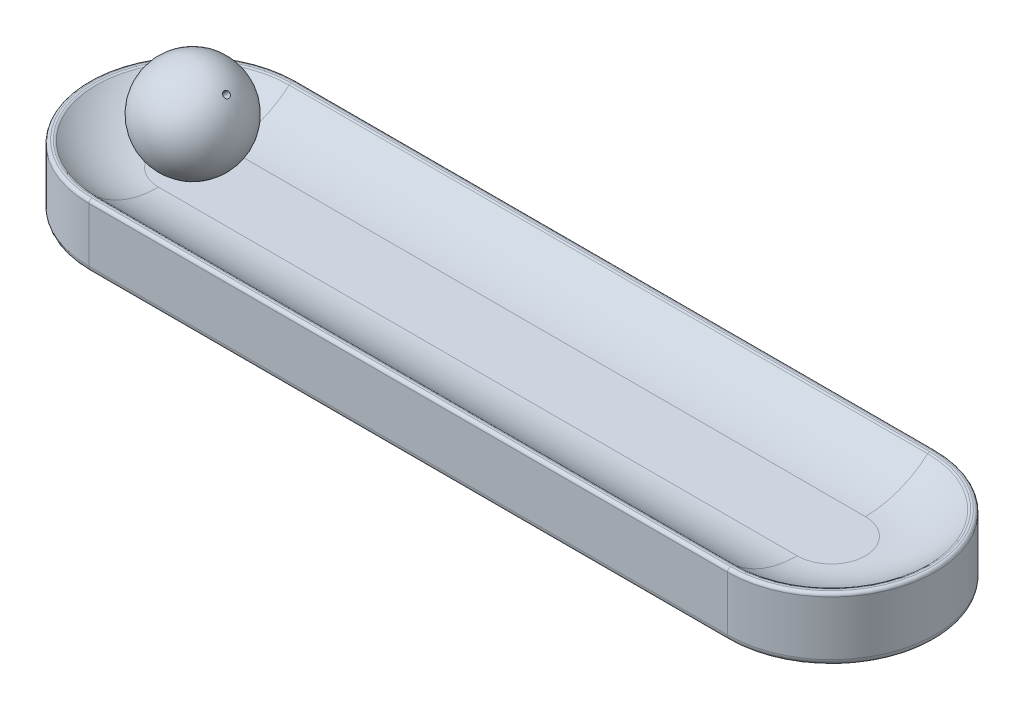
from build123d import *

# Parameters (mm, degrees)
BOSS_EXTRUDE1_DEPTH = 20
CUT_EXTRUDE1_DEPTH  = 7.5
FILLET1_R           = 30
FILLET2_R           = 1
FILLET3_R           = 2
SKETCH6_R           = 1
CUT_EXTRUDE2_DEPTH  = 15


with BuildPart() as part:
    # Sketch1 → Boss-Extrude1 (new body)
    with BuildSketch(Plane(origin=(0, 0, 0), x_dir=(1, 0, 0), z_dir=(0, 1, 0))):
        with BuildLine():
            Line((-100, 32.5), (100, 32.5))
            ThreePointArc((100, 32.5), (132.5, 0), (100, -32.5))
            Line((100, -32.5), (-100, -32.5))
            ThreePointArc((-100, -32.5), (-132.5, 0), (-100, 32.5))
        make_face()
    extrude(amount=BOSS_EXTRUDE1_DEPTH)

    # Sketch2 → Cut-Extrude1 (cut)
    with BuildSketch(Plane(origin=(0, 20, 0), x_dir=(1, 0, 0), z_dir=(0, 1, 0))):
        with BuildLine():
            Line((-100, -30.5), (100, -30.5))
            ThreePointArc((100, -30.5), (130.5, 0), (100, 30.5))
            Line((100, 30.5), (-100, 30.5))
            ThreePointArc((-100, 30.5), (-130.5, 0), (-100, -30.5))
        make_face()
    extrude(amount=-CUT_EXTRUDE1_DEPTH, mode=Mode.SUBTRACT)

    # Fillet1
    # the kernel refuses this fillet: 30 mm, written as the material it adds along each edge
    with BuildSketch(Plane(origin=(100, 12.5, -30.5), x_dir=(0, 1, 0), z_dir=(-1, 0, 0)), Plane(origin=(-100, 12.5, 30.5), x_dir=(0, 1, 0), z_dir=(1, 0, 0))) as fillet1_piece_1:
        with BuildLine():
            CenterArc((30, -19.843134833), FILLET1_R, 138.590377891, 41.409622109)
            Line((0, -19.843134833), (-0.6, -19.843134833))
            Line((-0.6, -19.843134833), (-0.6, 0))
            Line((-0.6, 0), (0, 0.6))
            ThreePointArc((0, 0.6), (3.75, 0.6), (7.05, 0.396862697))
            Line((7.05, 0.396862697), (7.5, 0))
        make_face()
    extrude(amount=200)
    with BuildSketch(Plane(origin=(-100, 12.5, 0), x_dir=(0, 0, -1), z_dir=(1, 0, 0))) as fillet1_piece_2:
        with BuildLine():
            CenterArc((10.656865167, 30), FILLET1_R, 270, 41.409622109)
            Line((10.656865167, 0), (10.656865167, -0.6))
            Line((10.656865167, -0.6), (30.5, -0.6))
            Line((30.5, -0.6), (31.1, 0))
            ThreePointArc((31.1, 0), (31.1, 3.75), (30.896862697, 7.05))
            Line((30.896862697, 7.05), (30.5, 7.5))
        make_face()
    revolve(axis=Axis((-100, 12.5, 0), (0, 1, 0)), revolution_arc=180)
    with BuildSketch(Plane(origin=(100, 12.5, 0), x_dir=(0, 0, 1), z_dir=(-1, 0, 0))) as fillet1_piece_3:
        with BuildLine():
            CenterArc((10.656865167, 30), FILLET1_R, 270, 41.409622109)
            Line((10.656865167, 0), (10.656865167, -0.6))
            Line((10.656865167, -0.6), (30.5, -0.6))
            Line((30.5, -0.6), (31.1, 0))
            ThreePointArc((31.1, 0), (31.1, 3.75), (30.896862697, 7.05))
            Line((30.896862697, 7.05), (30.5, 7.5))
        make_face()
    revolve(axis=Axis((100, 12.5, 0), (0, 1, 0)), revolution_arc=180)

    # Fillet2
    fillet2_edges = [part.edges().sort_by_distance(p)[0] for p in [
        (132.5, 20, 0),
        (0, 20, -32.5),
        (-130.5, 20, 0),
        (0, 20, 30.5),
        (130.5, 20, 0),
        (0, 20, -30.5),
        (-132.5, 20, 0),
        (0, 20, 32.5),
    ]]
    fillet(fillet2_edges, radius=FILLET2_R)

    # Fillet3
    fillet3_edges = [part.edges().sort_by_distance(p)[0] for p in [
        (0, 0, -32.5),
        (132.5, 0, 0),
        (0, 0, 32.5),
        (-132.5, 0, 0),
    ]]
    fillet(fillet3_edges, radius=FILLET3_R)

    # Sketch4 → Revolve1 (revolve)
    with BuildSketch(Plane.XY):
        with BuildLine():
            Line((-100, 12), (-100, 42))
            ThreePointArc((-100, 42), (-115, 27), (-100, 12))
        make_face()
    revolve(axis=Axis((-100, 12, 0), (0, 1, 0)))

    # Sketch6 → Cut-Extrude2 (cut)
    with BuildSketch(Plane(origin=(-25.893398282, -25.893398282, 0), x_dir=(0.7071067811865488, -0.7071067811865464, 0), z_dir=(0.7071067811865464, 0.7071067811865488, 0))):
        with Locations(Location((-89.802561211, 0, 0), (0, 0, 180))):
            Circle(SKETCH6_R)
    extrude(amount=-CUT_EXTRUDE2_DEPTH, mode=Mode.SUBTRACT)


solid = part.part
